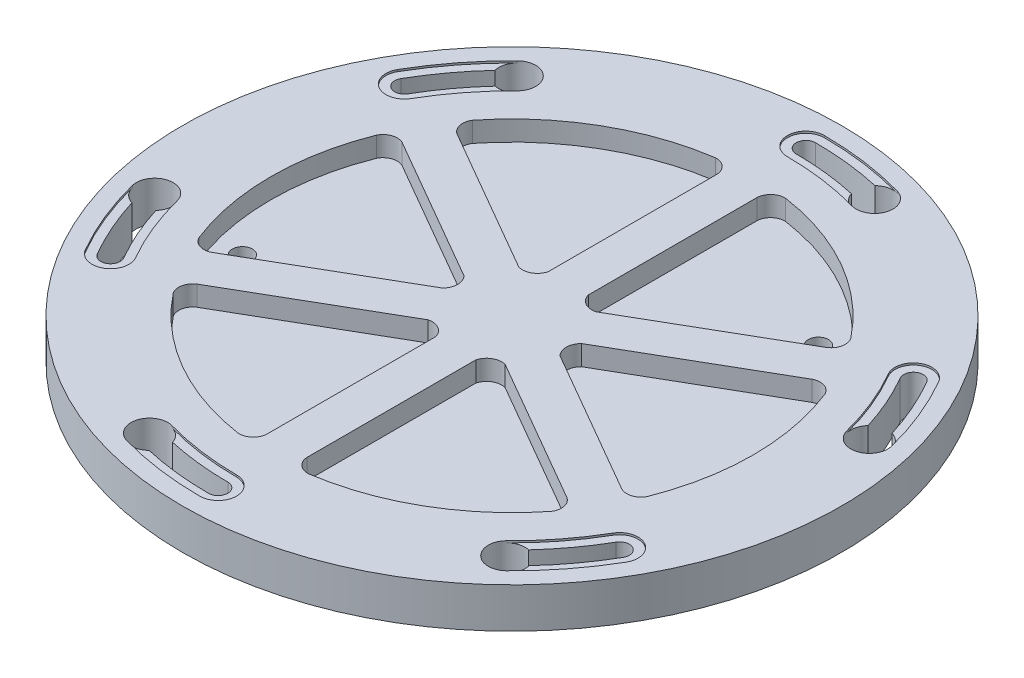
from build123d import *

# Parameters (mm, degrees)
SKETCH1_R           = 82
BOSS_EXTRUDE1_DEPTH = 10
BOSS_EXTRUDE3_DEPTH = 9.525
CIRPATTERN1_COUNT   = 6
CUT_EXTRUDE1_DEPTH  = 5
SKETCH3_R           = 2.5
CUT_EXTRUDE2_DEPTH  = 5
SKETCH3_3_R         = 2.5
CUT_EXTRUDE3_DEPTH  = 5


with BuildPart() as part:
    # Sketch1 → Boss-Extrude1 (new body)
    with BuildSketch(Plane(origin=(0, 0, 0), x_dir=(1, 0, 0), z_dir=(0, 1, 0))):
        Circle(SKETCH1_R)
        with BuildLine():
            ThreePointArc((0, -68.539794907), (4.585205093, -73.125), (0, -77.710205093))
            ThreePointArc((0, -77.710205093), (-10.627709007, -76.980047914), (-21.05570427, -74.803297343))
            ThreePointArc((-21.05570427, -74.803297343), (-24.227021824, -69.147242492), (-18.570966974, -65.975924939))
            ThreePointArc((-18.570966974, -65.975924939), (-9.373556469, -67.895801969), (0, -68.539794907))
        make_face(mode=Mode.SUBTRACT)
        with BuildLine():
            ThreePointArc((-59.357203559, -34.269897453), (-61.035505105, -40.533404092), (-67.299011744, -38.855102547))
            ThreePointArc((-67.299011744, -38.855102547), (-71.980531582, -29.286157973), (-75.309407921, -19.166873879))
            ThreePointArc((-75.309407921, -19.166873879), (-71.996779512, -13.592404889), (-66.422310522, -16.905033297))
            ThreePointArc((-66.422310522, -16.905033297), (-63.48626755, -25.830162958), (-59.357203559, -34.269897453))
        make_face(mode=Mode.SUBTRACT)
        with BuildLine():
            ThreePointArc((59.357203559, -34.269897453), (65.620710198, -32.591595908), (67.299011744, -38.855102547))
            ThreePointArc((67.299011744, -38.855102547), (61.352822575, -47.693889942), (54.25370365, -55.636423464))
            ThreePointArc((54.25370365, -55.636423464), (47.769757688, -55.554837604), (47.851343548, -49.070891641))
            ThreePointArc((47.851343548, -49.070891641), (54.112711081, -42.065639011), (59.357203559, -34.269897453))
        make_face(mode=Mode.SUBTRACT)
        with BuildLine():
            ThreePointArc((-59.357203559, 34.269897453), (-65.620710198, 32.591595908), (-67.299011744, 38.855102547))
            ThreePointArc((-67.299011744, 38.855102547), (-61.352822575, 47.693889942), (-54.25370365, 55.636423464))
            ThreePointArc((-54.25370365, 55.636423464), (-47.769757688, 55.554837604), (-47.851343548, 49.070891641))
            ThreePointArc((-47.851343548, 49.070891641), (-54.112711081, 42.065639011), (-59.357203559, 34.269897453))
        make_face(mode=Mode.SUBTRACT)
        with BuildLine():
            ThreePointArc((59.357203559, 34.269897453), (61.035505105, 40.533404092), (67.299011744, 38.855102547))
            ThreePointArc((67.299011744, 38.855102547), (71.980531582, 29.286157973), (75.309407921, 19.166873879))
            ThreePointArc((75.309407921, 19.166873879), (71.996779512, 13.592404889), (66.422310522, 16.905033297))
            ThreePointArc((66.422310522, 16.905033297), (63.48626755, 25.830162958), (59.357203559, 34.269897453))
        make_face(mode=Mode.SUBTRACT)
        with BuildLine():
            ThreePointArc((0, 68.539794907), (-4.585205093, 73.125), (0, 77.710205093))
            ThreePointArc((0, 77.710205093), (10.627709007, 76.980047914), (21.05570427, 74.803297343))
            ThreePointArc((21.05570427, 74.803297343), (24.227021824, 69.147242492), (18.570966974, 65.975924939))
            ThreePointArc((18.570966974, 65.975924939), (9.373556469, 67.895801969), (0, 68.539794907))
        make_face(mode=Mode.SUBTRACT)
    extrude(amount=BOSS_EXTRUDE1_DEPTH)

    # Sketch1<4> → Boss-Extrude3 (add)
    with BuildSketch(Plane(origin=(0, 0, 0), x_dir=(1, 0, 0), z_dir=(0, 1, 0))):
        with BuildLine():
            ThreePointArc((-75.309407921, -19.166873879), (-71.980531582, -29.286157973), (-67.299011744, -38.855102547))
            ThreePointArc((-67.299011744, -38.855102547), (-61.035505105, -40.533404092), (-59.357203559, -34.269897453))
            ThreePointArc((-59.357203559, -34.269897453), (-63.48626755, -25.830162958), (-66.422310522, -16.905033297))
            ThreePointArc((-66.422310522, -16.905033297), (-66.418285743, -19.150940539), (-67.48132535, -21.129339471))
            ThreePointArc((-67.48132535, -21.129339471), (-64.751733563, -28.414631056), (-61.238335159, -35.355969289))
            ThreePointArc((-61.238335159, -35.355969289), (-62.121576941, -38.652272492), (-65.417880144, -37.769030711))
            ThreePointArc((-65.417880144, -37.769030711), (-69.197773577, -30.293016611), (-72.126599919, -22.444427093))
            ThreePointArc((-72.126599919, -22.444427093), (-74.155284422, -21.230290389), (-75.309407921, -19.166873879))
        make_face()
    boss_extrude3 = extrude(amount=BOSS_EXTRUDE3_DEPTH)

    # CirPattern1: Boss-Extrude3 ×6 about axis
    cirpattern1_axis = Axis((0, 10, 0), (0, 1, 0))
    for i in range(1, CIRPATTERN1_COUNT):
        add(boss_extrude3.rotate(cirpattern1_axis, i * 360 / CIRPATTERN1_COUNT))

    # Sketch2 → Cut-Extrude1 (cut)
    with BuildSketch(Plane(origin=(0, 10, 0), x_dir=(1, 0, 0), z_dir=(0, 1, 0))):
        with BuildLine():
            Line((-14.620190528, 2.667468245), (-51.015872171, 23.680524839))
            ThreePointArc((-51.015872171, 23.680524839), (-53.723615936, 23.879831653), (-55.779211114, 22.106098875))
            ThreePointArc((-55.779211114, 22.106098875), (-60, 0), (-55.779211114, -22.106098875))
            ThreePointArc((-55.779211114, -22.106098875), (-53.723615936, -23.879831653), (-51.015872171, -23.680524839))
            Line((-51.015872171, -23.680524839), (-14.620190528, -2.667468245))
            ThreePointArc((-14.620190528, -2.667468245), (-13.515289004, 0), (-14.620190528, 2.667468245))
        make_face()
        with BuildLine():
            Line((-5, 13.995190528), (-5, 56.021303716))
            ThreePointArc((-5, 56.021303716), (-6.181267118, 58.46593201), (-8.745162353, 59.359263266))
            ThreePointArc((-8.745162353, 59.359263266), (-30, 51.961524227), (-47.034048761, 37.253164391))
            ThreePointArc((-47.034048761, 37.253164391), (-47.542348818, 34.586100357), (-46.015872171, 32.340778877))
            Line((-46.015872171, 32.340778877), (-9.620190528, 11.327722283))
            ThreePointArc((-9.620190528, 11.327722283), (-6.757644502, 11.704583617), (-5, 13.995190528))
        make_face()
        with BuildLine():
            Line((-9.620190528, -11.327722283), (-46.015872171, -32.340778877))
            ThreePointArc((-46.015872171, -32.340778877), (-47.542348818, -34.586100357), (-47.034048761, -37.253164391))
            ThreePointArc((-47.034048761, -37.253164391), (-30, -51.961524227), (-8.745162353, -59.359263266))
            ThreePointArc((-8.745162353, -59.359263266), (-6.181267118, -58.46593201), (-5, -56.021303716))
            Line((-5, -56.021303716), (-5, -13.995190528))
            ThreePointArc((-5, -13.995190528), (-6.757644502, -11.704583617), (-9.620190528, -11.327722283))
        make_face()
        with BuildLine():
            Line((9.620190528, 11.327722283), (46.015872171, 32.340778877))
            ThreePointArc((46.015872171, 32.340778877), (47.542348818, 34.586100357), (47.034048761, 37.253164391))
            ThreePointArc((47.034048761, 37.253164391), (30, 51.961524227), (8.745162353, 59.359263266))
            ThreePointArc((8.745162353, 59.359263266), (6.181267118, 58.46593201), (5, 56.021303716))
            Line((5, 56.021303716), (5, 13.995190528))
            ThreePointArc((5, 13.995190528), (6.757644502, 11.704583617), (9.620190528, 11.327722283))
        make_face()
        with BuildLine():
            Line((14.620190528, -2.667468245), (51.015872171, -23.680524839))
            ThreePointArc((51.015872171, -23.680524839), (53.723615936, -23.879831653), (55.779211114, -22.106098875))
            ThreePointArc((55.779211114, -22.106098875), (60, 0), (55.779211114, 22.106098875))
            ThreePointArc((55.779211114, 22.106098875), (53.723615936, 23.879831653), (51.015872171, 23.680524839))
            Line((51.015872171, 23.680524839), (14.620190528, 2.667468245))
            ThreePointArc((14.620190528, 2.667468245), (13.515289004, 0), (14.620190528, -2.667468245))
        make_face()
        with BuildLine():
            Line((5, -13.995190528), (5, -56.021303716))
            ThreePointArc((5, -56.021303716), (6.181267118, -58.46593201), (8.745162353, -59.359263266))
            ThreePointArc((8.745162353, -59.359263266), (30, -51.961524227), (47.034048761, -37.253164391))
            ThreePointArc((47.034048761, -37.253164391), (47.542348818, -34.586100357), (46.015872171, -32.340778877))
            Line((46.015872171, -32.340778877), (9.620190528, -11.327722283))
            ThreePointArc((9.620190528, -11.327722283), (6.757644502, -11.704583617), (5, -13.995190528))
        make_face()
    extrude(amount=-CUT_EXTRUDE1_DEPTH, mode=Mode.SUBTRACT)

    # Sketch3 → Cut-Extrude2 (cut)
    with BuildSketch(Plane.XZ):
        with Locations((-51.685176347, 15.403969857)):
            Circle(SKETCH3_R)
    extrude(amount=-CUT_EXTRUDE2_DEPTH, mode=Mode.SUBTRACT)

    # Sketch3<3> → Cut-Extrude3 (cut)
    with BuildSketch(Plane.XZ):
        with Locations((39.46740468, -36.755458224)):
            Circle(SKETCH3_3_R)
    extrude(amount=-CUT_EXTRUDE3_DEPTH, mode=Mode.SUBTRACT)


solid = part.part
